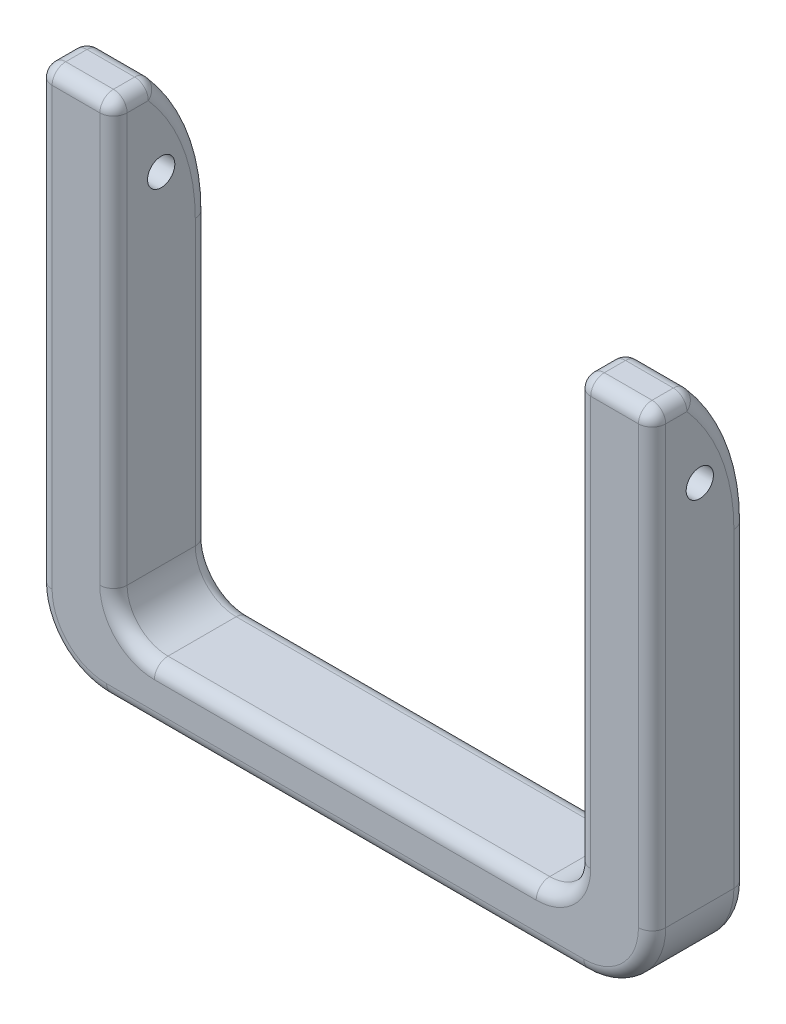
from build123d import *

# Parameters (mm, degrees)
EXTRUDE_1_DEPTH     = 7
SKETCH_3_R          = 1
CUT_EXTRUDE_2_DEPTH = 57.833088954
SKETCH_4_R          = 1.75
CUT_EXTRUDE_3_DEPTH = 2.5
CUT_EXTRUDE_1_DEPTH = 57.833088954
FILLET_2_R          = 15
FILLET_3_R          = 1


# Some blends are built 0.0001 mm under size
with BuildPart() as part:
    # 草图1 → 凸台-拉伸1 (new body)
    with BuildSketch(Plane.XY):
        with BuildLine():
            Line((14, 0), (-14, 0))
            ThreePointArc((-14, 0), (-16.121320344, 0.878679656), (-17, 3))
            Line((-17, 3), (-17, 34))
            Line((-17, 34), (-22.5, 34))
            Line((-22.5, 34), (-22.5, 1))
            ThreePointArc((-22.5, 1), (-21.035533906, -2.535533906), (-17.5, -4))
            Line((-17.5, -4), (17.5, -4))
            ThreePointArc((17.5, -4), (21.035533906, -2.535533906), (22.5, 1))
            Line((22.5, 1), (22.5, 34))
            Line((22.5, 34), (17, 34))
            Line((17, 34), (17, 3))
            ThreePointArc((17, 3), (16.121320344, 0.878679656), (14, 0))
        make_face()
    extrude(amount=EXTRUDE_1_DEPTH)

    # 草图3 → 切除-拉伸2 (cut, through all)
    with BuildSketch(Plane.ZY.offset(22.5)):
        with Locations(Location((3.5, 28, 0), (0, 0, 270))):
            Circle(SKETCH_3_R)
    extrude(amount=-CUT_EXTRUDE_2_DEPTH, mode=Mode.SUBTRACT)

    # 草图4 → 切除-拉伸3 (cut)
    with BuildSketch(Plane(origin=(0, 0, 0), x_dir=(-1, 0, 0), z_dir=(0, 0, -1))):
        with Locations((-19.75, 6)):
            Circle(SKETCH_4_R)
        with Locations(Location((19.75, 6, 0), (0, 0, 180))):
            Circle(SKETCH_4_R)
    extrude(amount=-CUT_EXTRUDE_3_DEPTH, mode=Mode.SUBTRACT)

    # 草图2 → 切除-拉伸1 (cut, through all)
    with BuildSketch(Plane.ZY.offset(22.5)):
        Polygon((0, 30), (4, 34), (7, 34), (7, 35.188575271), (0, 35.188575271), align=None)
    extrude(amount=-CUT_EXTRUDE_1_DEPTH, mode=Mode.SUBTRACT)

    # 圆角2
    # the kernel refuses this fillet: 15 mm, written as the material it takes off along each edge
    with BuildSketch(Plane(origin=(-37.995097568, 30, 0), x_dir=(0, -1, 0), z_dir=(1, 0, 0)), Plane(origin=(1.504902432, 30, 0), x_dir=(0, -1, 0), z_dir=(1, 0, 0))) as fillet_2_piece_1:
        with BuildLine():
            CenterArc((6.198039027, -15), FILLET_2_R, 90, 42.833428066)
            Line((-4, -4), (-4.203960781, -3.78))
            ThreePointArc((-4.203960781, -3.78), (-2.212132034, -1.787867966), (-0.212132034, 0.212132034))
            Line((-0.212132034, 0.212132034), (0, 0.3))
            Line((0, 0.3), (6.198039027, 0.3))
            Line((6.198039027, 0.3), (6.198039027, 0))
        make_face()
    extrude(amount=36.490195136, mode=Mode.SUBTRACT)

    # 圆角3
    fillet_3_edges = [part.edges().sort_by_distance(p)[0] for p in [
        (-17, 13.400980486, 0),
        (-16.121320344, 0.878679656, 0),
        (-21.035533906, -2.535533906, 7),
        (0, 0, 0),
        (16.121320344, 0.878679656, 0),
        (22.5, 12.400980486, 0),
        (21.035533906, -2.535533906, 0),
        (0, -4, 0),
        (-21.035533906, -2.535533906, 0),
        (0, -4, 7),
        (-17, 34, 5.5),
        (21.035533906, -2.535533906, 7),
        (17, 34, 5.5),
        (22.5, 34, 5.5),
        (-22.5, 34, 5.5),
        (22.5, 17.5, 7),
        (19.75, 34, 7),
        (17, 18.5, 7),
        (16.121320344, 0.878679656, 7),
        (0, 0, 7),
        (-16.121320344, 0.878679656, 7),
        (-17, 18.5, 7),
        (-19.75, 34, 7),
        (19.75, 34, 4),
        (-19.75, 34, 4),
        (17, 13.400980486, 0),
        (17, 29.279186548, 1.035759956),
        (-22.5, 12.400980486, 0),
        (22.5, 29.279186548, 1.035759956),
        (-17, 29.279186548, 1.035759956),
        (-22.5, 29.279186548, 1.035759956),
        (-22.5, 17.5, 7),
    ]]
    fillet(fillet_3_edges, radius=FILLET_3_R - 0.0001)  # a hair under: the kernel refuses the full size


solid = part.part
